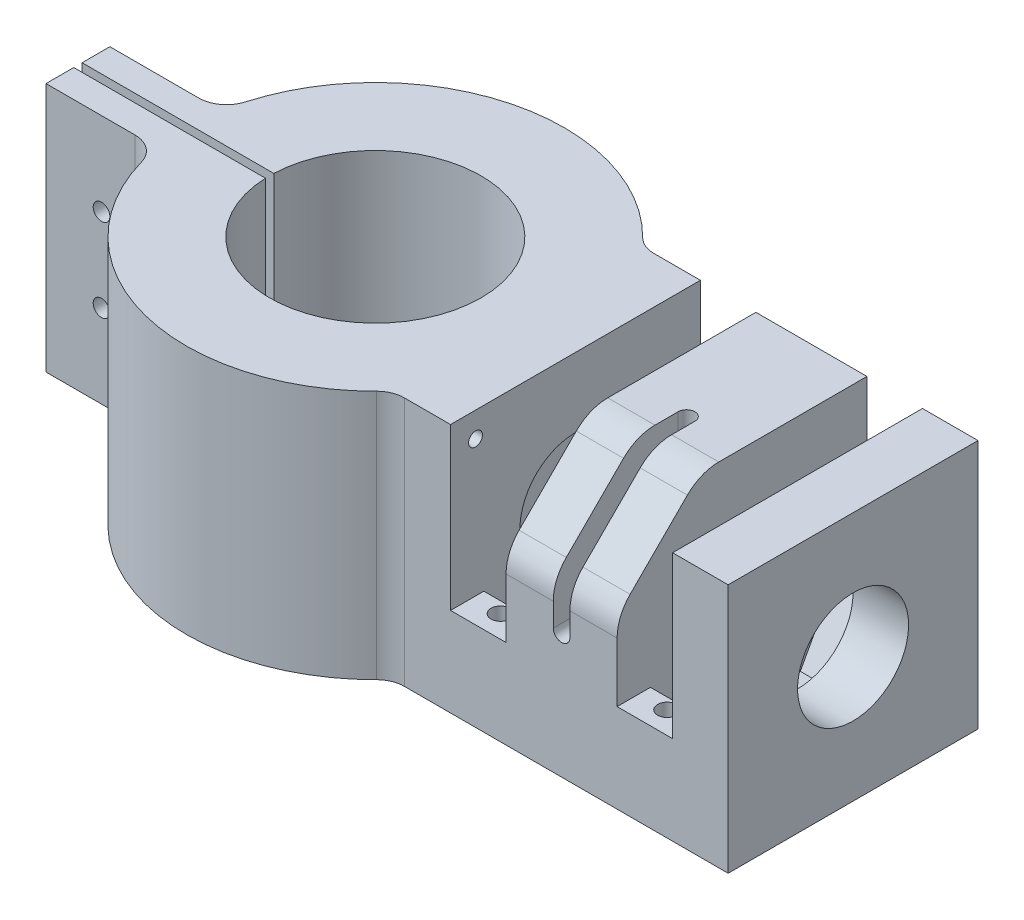
from build123d import *

# Parameters (mm, degrees)
BOSS_EXTRUDE1_DEPTH             = 22.5
F_3_0MM_DOWEL_HOLE1_D           = 3
BOSS_EXTRUDE2_START             = -8.493151603
BOSS_EXTRUDE2_OUTLINE_W         = 45
BOSS_EXTRUDE2_OUTLINE_H         = 45
BOSS_EXTRUDE2_DEPTH             = 60.493151603
SKETCH5_R                       = 10
CUT_EXTRUDE1_DEPTH              = 60
CUT_EXTRUDE2_START              = 22.5
SKETCH7_W                       = 10
SKETCH7_H                       = 45
CUT_EXTRUDE2_DEPTH              = 40
SKETCH8_W                       = 22.5
SKETCH8_H                       = 22.5
CUT_EXTRUDE3_DEPTH              = 1.5
CUT_EXTRUDE5_OUTLINE_W          = 1.5
CUT_EXTRUDE5_OUTLINE_H          = 12.613186919
CUT_EXTRUDE8_START              = 9.886859865
CUT_EXTRUDE8_DEPTH              = 12.613140135
CHAMFER1_SIZE                   = 15
FILLET3_R                       = 5
FILLET2_R                       = 8
BOSS_EXTRUDE3_DEPTH             = 40
M3X0_5_TAPPED_HOLE1_D           = 2.5
M3X0_5_TAPPED_HOLE1_DEPTH       = 25
M3X0_5_TAPPED_HOLE1_TIP         = 0.751075774
CBORE_FOR_M3_SBHCS1_D           = 3.4
CBORE_FOR_M3_SBHCS1_DEPTH       = 16
CBORE_FOR_M3_SBHCS1_CBORE_D     = 6.7
CBORE_FOR_M3_SBHCS1_CBORE_DEPTH = 2.65
CBORE_FOR_M3_SBHCS1_TIP         = 1.021463052


# Read off the part's stored shape, not the designer's step: Boss-Extrude2, Cut-Extrude5, Cut-Extrude8
with BuildPart() as part:
    # Sketch3 → Boss-Extrude1 (new, symmetric)
    with BuildSketch(Plane(origin=(0, 0, 0), x_dir=(1, 0, 0), z_dir=(0, 1, 0))):
        with BuildLine():
            Line((-53.560989258, 0.75), (-53.560989258, 5.75))
            Line((-53.560989258, 5.75), (-33.560989258, 5.75))
            ThreePointArc((-33.560989258, 5.75), (34.05, 0), (-33.560989258, -5.75))
            Line((-33.560989258, -5.75), (-53.560989258, -5.75))
            Line((-53.560989258, -5.75), (-53.560989258, -0.75))
            Line((-53.560989258, -0.75), (-19.035230495, -0.75))
            ThreePointArc((-19.035230495, -0.75), (19.05, 0), (-19.035230495, 0.75))
            Line((-19.035230495, 0.75), (-53.560989258, 0.75))
        make_face()
    extrude(amount=BOSS_EXTRUDE1_DEPTH, both=True)

    # Ø3.0mm Dowel Hole1 (through all)
    with Locations(Plane.XY.offset(5.75)):
        with Locations((-43.560989258, 7.5), (-43.560989258, -7.5)):
            Hole(F_3_0MM_DOWEL_HOLE1_D / 2)

    # Boss-Extrude2 outline → Boss-Extrude2 (add)
    with BuildSketch(Plane(origin=(34.05, 0, 0), x_dir=(0, 0, -1), z_dir=(1, 0, 0)).offset(BOSS_EXTRUDE2_START)):
        Rectangle(BOSS_EXTRUDE2_OUTLINE_W, BOSS_EXTRUDE2_OUTLINE_H)
    extrude(amount=BOSS_EXTRUDE2_DEPTH)

    # Sketch5 → Cut-Extrude1 (cut)
    with BuildSketch(Plane(origin=(86.05, 0, 0), x_dir=(0, 0, -1), z_dir=(1, 0, 0))):
        Circle(SKETCH5_R)
    extrude(amount=-CUT_EXTRUDE1_DEPTH, mode=Mode.SUBTRACT)

    # Sketch7 → Cut-Extrude2 (cut)
    with BuildSketch(Plane(origin=(0, 0, 0), x_dir=(1, 0, 0), z_dir=(0, 1, 0)).offset(CUT_EXTRUDE2_START)):
        with Locations((71.05, 0)):
            Rectangle(SKETCH7_W, SKETCH7_H)
        with Locations((41.05, 0)):
            Rectangle(SKETCH7_W, SKETCH7_H)
    extrude(amount=-CUT_EXTRUDE2_DEPTH, mode=Mode.SUBTRACT)

    # Sketch8 → Cut-Extrude3 (cut, symmetric)
    with BuildSketch(Plane(origin=(56.05, 0, 0), x_dir=(0, 0, -1), z_dir=(1, 0, 0))):
        with Locations((-11.25, 11.25)):
            Rectangle(SKETCH8_W, SKETCH8_H)
    extrude(amount=CUT_EXTRUDE3_DEPTH, both=True, mode=Mode.SUBTRACT)

    # Cut-Extrude5 outline → Cut-Extrude5 (revolve, cut)
    with BuildSketch(Plane(origin=(56.05, 0, 0), x_dir=(1, 0, 0), z_dir=(0, -1, 0))):
        with Locations((0.75, 16.19340654)):
            Rectangle(CUT_EXTRUDE5_OUTLINE_W, CUT_EXTRUDE5_OUTLINE_H)
    revolve(axis=Axis((56.05, 0, 0), (0, 0, 1)), mode=Mode.SUBTRACT)

    # Cut-Extrude8 outline → Cut-Extrude8 (cut)
    with BuildSketch(Plane(origin=(0, 0, 0), x_dir=(1, 0, 0), z_dir=(0, 1, 0)).offset(CUT_EXTRUDE8_START)):
        with BuildLine():
            ThreePointArc((57.55, 0), (56.05, 1.5), (54.55, 0))
            Line((54.55, 0), (57.55, 0))
        make_face()
    extrude(amount=CUT_EXTRUDE8_DEPTH, mode=Mode.SUBTRACT)

    # Chamfer1
    chamfer1_edges = [part.edges().sort_by_distance(p)[0] for p in [
        (61.8, 22.5, 22.5),
        (50.3, 22.5, 22.5),
    ]]
    chamfer(chamfer1_edges, length=CHAMFER1_SIZE)

    # Fillet3
    fillet3_edges = [part.edges().sort_by_distance(p)[0] for p in [
        (-33.560989258, 0, -5.75),
        (-33.560989258, 0, 5.75),
        (25.556848397, 0, -22.5),
        (25.556848397, 0, 22.5),
    ]]
    fillet(fillet3_edges, radius=FILLET3_R)

    # Fillet2
    fillet2_edges = [part.edges().sort_by_distance(p)[0] for p in [
        (50.3, 22.5, 7.5),
        (61.8, 22.5, 7.5),
        (50.3, 7.5, 22.5),
        (61.8, 7.5, 22.5),
    ]]
    fillet(fillet2_edges, radius=FILLET2_R)

    # Sketch15 → Boss-Extrude3 (add)
    with BuildSketch(Plane(origin=(36.05, 0, 0), x_dir=(0, 0, -1), z_dir=(1, 0, 0))):
        Polygon((-22.5, -6.5), (-16.5, -6.5), (-10.5, -17.5), (-22.5, -17.5), align=None)
        Polygon((22.5, -6.5), (16.5, -6.5), (10.5, -17.5), (22.5, -17.5), align=None)
    extrude(amount=BOSS_EXTRUDE3_DEPTH)

    # M3x0.5 Tapped Hole1
    with Locations(Plane(origin=(0, -22.5, 0), x_dir=(-1, 0, 0), z_dir=(0, -1, 0))):
        with Locations((-41.05, -18.5), (-71.05, 18.5), (-71.05, -18.5), (-41.05, 18.5)):
            Hole(M3X0_5_TAPPED_HOLE1_D / 2, depth=M3X0_5_TAPPED_HOLE1_DEPTH)
            with Locations((0, 0, -(M3X0_5_TAPPED_HOLE1_DEPTH + M3X0_5_TAPPED_HOLE1_TIP / 2))):  # 118° drill point
                Cone(0, M3X0_5_TAPPED_HOLE1_D / 2, M3X0_5_TAPPED_HOLE1_TIP, mode=Mode.SUBTRACT)

    # Sketch16 → M3x0.5 Tapped Hole2 (revolve, cut)
    with BuildSketch(Plane(origin=(46.05, 18, 18), x_dir=(0, 0, -1), z_dir=(0, 1, 0))):
        Polygon((0, 0), (0, 15.751075774), (1.25, 15), (1.25, 0), align=None)
    revolve(axis=Axis((52.4, 18, 18), (-1, 0, 0)), mode=Mode.SUBTRACT)

    # CBORE for M3 SBHCS1
    with Locations(Plane(origin=(0, -22.5, 0), x_dir=(-1, 0, 0), z_dir=(0, -1, 0))):
        with Locations((-71.05, 18.5), (-41.05, 18.5), (-41.05, -18.5), (-71.05, -18.5)):
            CounterBoreHole(CBORE_FOR_M3_SBHCS1_D / 2, CBORE_FOR_M3_SBHCS1_CBORE_D / 2, CBORE_FOR_M3_SBHCS1_CBORE_DEPTH, depth=CBORE_FOR_M3_SBHCS1_DEPTH)
            with Locations((0, 0, -(CBORE_FOR_M3_SBHCS1_DEPTH + CBORE_FOR_M3_SBHCS1_TIP / 2))):  # 118° drill point
                Cone(0, CBORE_FOR_M3_SBHCS1_D / 2, CBORE_FOR_M3_SBHCS1_TIP, mode=Mode.SUBTRACT)


solid = part.part
